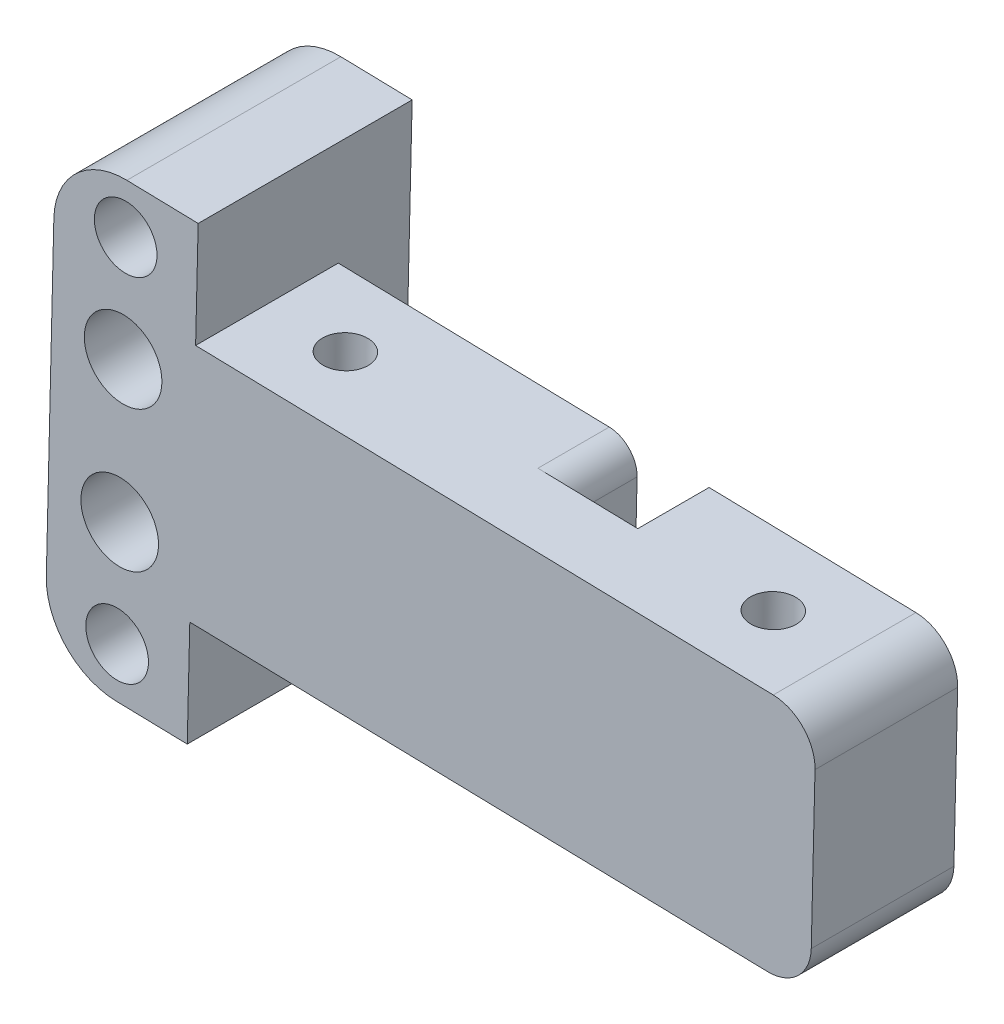
from build123d import *

# Parameters (mm, degrees)
EXTRUDE_1_DEPTH      = 15
CUT_EXTRUDE_1_DEPTH  = 5
SKETCH_3_R           = 1.6
SKETCH_3_W           = 5
SKETCH_3_H           = 5
CUT_EXTRUDE_2_DEPTH  = 22
FILLET_1_R           = 2
EXTRUDE_2_DEPTH      = 5.5
EXTRUDE_2_DEPTH_BACK = 3
SKETCH_4_W           = 10
SKETCH_4_H           = 17
SKETCH_5_R           = 1.6
CUT_EXTRUDE_3_DEPTH  = 20.5
FILLET_2_R           = 3


with BuildPart() as part:
    # 草图1 → 凸台-拉伸1 (new body)
    with BuildSketch(Plane.XY):
        with BuildLine():
            Line((24.185160084, -7.016301696), (24.496510845, 5.979969335))
            ThreePointArc((24.496510845, 5.979969335), (23.944762934, 7.407806858), (22.544984649, 8.027295764))
            Line((22.544984649, 8.027295764), (-13.444688974, 8.889497871))
            Line((-13.444688974, 8.889497871), (-13.265063535, 16.387346543))
            Line((-13.265063535, 16.387346543), (-18.263629316, 16.507096835))
            ThreePointArc((-18.263629316, 16.507096835), (-21.833223125, 15.127727058), (-23.38194539, 11.628281347))
            Line((-23.38194539, 11.628281347), (-23.908846678, -10.36540809))
            ThreePointArc((-23.908846678, -10.36540809), (-22.5294769, -13.935001898), (-19.030031189, -15.483724163))
            Line((-19.030031189, -15.483724163), (-14.031465408, -15.603474456))
            Line((-14.031465408, -15.603474456), (-13.851839969, -8.105625784))
            Line((-13.851839969, -8.105625784), (22.137833654, -8.967827891))
            ThreePointArc((22.137833654, -8.967827891), (23.565671178, -8.41607998), (24.185160084, -7.016301696))
        make_face()
        with BuildLine():
            ThreePointArc((-16.75044735, -12.037331753), (-18.893602347, -9.788969482), (-21.141964619, -11.93212448))
            ThreePointArc((-21.141964619, -11.93212448), (-18.998809621, -14.180486751), (-16.75044735, -12.037331753))
        make_face(mode=Mode.SUBTRACT)
        with BuildLine():
            ThreePointArc((-16.04728092, -4.552025517), (-18.701434473, -1.76757982), (-21.48588017, -4.421733373))
            ThreePointArc((-21.48588017, -4.421733373), (-18.831726617, -7.20617907), (-16.04728092, -4.552025517))
        make_face(mode=Mode.SUBTRACT)
        with BuildLine():
            ThreePointArc((-15.807780335, 5.445106045), (-18.461933888, 8.229551742), (-21.246379585, 5.575398189))
            ThreePointArc((-21.246379585, 5.575398189), (-18.592226032, 2.790952492), (-15.807780335, 5.445106045))
        make_face(mode=Mode.SUBTRACT)
        with BuildLine():
            ThreePointArc((-16.151695887, 12.955497152), (-18.294850884, 15.203859423), (-20.543213156, 13.060704426))
            ThreePointArc((-20.543213156, 13.060704426), (-18.400058158, 10.812342154), (-16.151695887, 12.955497152))
        make_face(mode=Mode.SUBTRACT)
    extrude(amount=-EXTRUDE_1_DEPTH)

    # 草图2 → 切除-拉伸1 (cut)
    with BuildSketch(Plane(origin=(0, 0, -15), x_dir=(-1, 0, 0), z_dir=(0, 0, -1))):
        Polygon((13.444688974, 8.889497871), (13.851839969, -8.105625784), (-33.415838559, -15.121344773), (-27.379501609, 15.743180277), align=None)
    extrude(amount=-CUT_EXTRUDE_1_DEPTH, mode=Mode.SUBTRACT)

    # 草图3 → 切除-拉伸2 (cut)
    with BuildSketch(Plane(origin=(0.205130979, 8.562490084, 0), x_dir=(0.9997131562086496, -0.02395005852477245, 0), z_dir=(0.02395005852477245, 0.9997131562086496, 0))):
        with Locations((21.846263557, 5)):
            Circle(SKETCH_3_R)
        with Locations((-8.153736443, 5)):
            Circle(SKETCH_3_R)
        with Locations((9.846263557, 7.5)):
            Rectangle(SKETCH_3_W, SKETCH_3_H)
    extrude(amount=-CUT_EXTRUDE_2_DEPTH, mode=Mode.SUBTRACT)

    # 圆角1
    fillet_1_edges = [part.edges().sort_by_distance(p)[0] for p in [
        (7.142136311, -8.608577013, -7.5),
        (7.549287306, 8.386546642, -7.5),
    ]]
    fillet(fillet_1_edges, radius=FILLET_1_R)

    # 草图4 → 凸台-拉伸2 (add, two sides: drawn at the far end of the back side and taken through both)
    with BuildSketch(Plane(origin=(24.339279983, -0.583094437, 0), x_dir=(0, 0, -1), z_dir=(0.9997131562086496, -0.023950058524773866, 0)).offset(-EXTRUDE_2_DEPTH_BACK)):
        with Locations((5, 0.064946886)):
            Rectangle(SKETCH_4_W, SKETCH_4_H)
    extrude(amount=EXTRUDE_2_DEPTH + EXTRUDE_2_DEPTH_BACK)

    # 草图5 → 切除-拉伸3 (cut)
    with BuildSketch(Plane(origin=(0.205130979, 8.562490084, 0), x_dir=(0.9997131562086496, -0.02395005852477245, 0), z_dir=(0.02395005852477245, 0.9997131562086496, 0))):
        with Locations((21.846263557, 5)):
            Circle(SKETCH_5_R)
    extrude(amount=-CUT_EXTRUDE_3_DEPTH, mode=Mode.SUBTRACT)

    # 圆角2
    fillet_2_edges = [part.edges().sort_by_distance(p)[0] for p in [
        (29.635682326, -9.14745333, -5),
        (30.042833321, 7.847670325, -5),
    ]]
    fillet(fillet_2_edges, radius=FILLET_2_R)


solid = part.part
